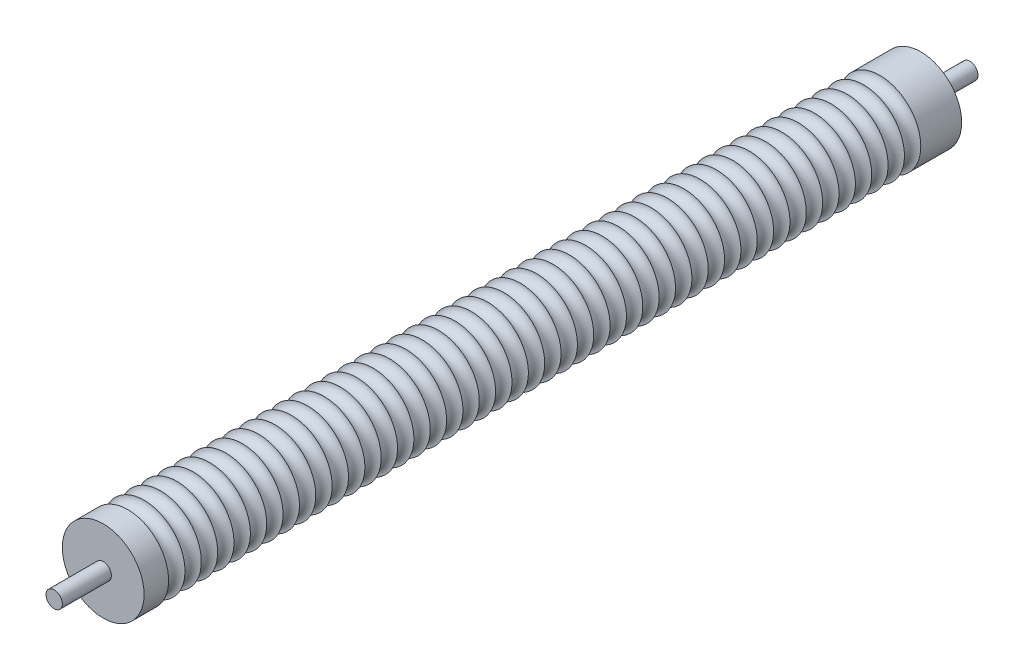
from build123d import *
from build123d.topology import SkipClean

# Parameters (mm, degrees)
SKETCH1_R           = 50
BOSS_EXTRUDE1_DEPTH = 1000
SKETCH2_R           = 10
SKETCH3_R           = 10
BOSS_EXTRUDE2_DEPTH = 60
LPATTERN4_COUNT     = 46
LPATTERN4_PITCH     = 20


with BuildPart() as part:
    # Sketch1 → Boss-Extrude1 (new body)
    with BuildSketch(Plane.XY):
        Circle(SKETCH1_R)
    extrude(amount=BOSS_EXTRUDE1_DEPTH)

    # Sketch2 → Cut-Revolve1 (revolve, cut)
    with BuildSketch(Plane(origin=(0, 0, 0), x_dir=(1, 0, 0), z_dir=(0, 1, 0))):
        with Locations((-50, -960)):
            Circle(SKETCH2_R)
    cut_revolve1 = revolve(axis=Axis((0, 0, 0), (0, 0, 1)), mode=Mode.SUBTRACT)

    # Sketch3 → Boss-Extrude2 (add)
    with BuildSketch(Plane.XY.offset(1000)):
        Circle(SKETCH3_R)
    boss_extrude2 = extrude(amount=BOSS_EXTRUDE2_DEPTH)

    # Mirror1: Boss-Extrude2 across plane
    add(boss_extrude2.mirror(Plane.XY.offset(500)))

    # LPattern4: Cut-Revolve1 ×46
    with SkipClean():  # the faces are left unmerged after this step: merging them gives an invalid solid
        with Locations(*[(0, 0, -i * LPATTERN4_PITCH) for i in range(1, LPATTERN4_COUNT)]):
            add(cut_revolve1, mode=Mode.SUBTRACT)
    add(part.part.scale(1), mode=Mode.REPLACE)  # the faces are merged on a copy


solid = part.part
